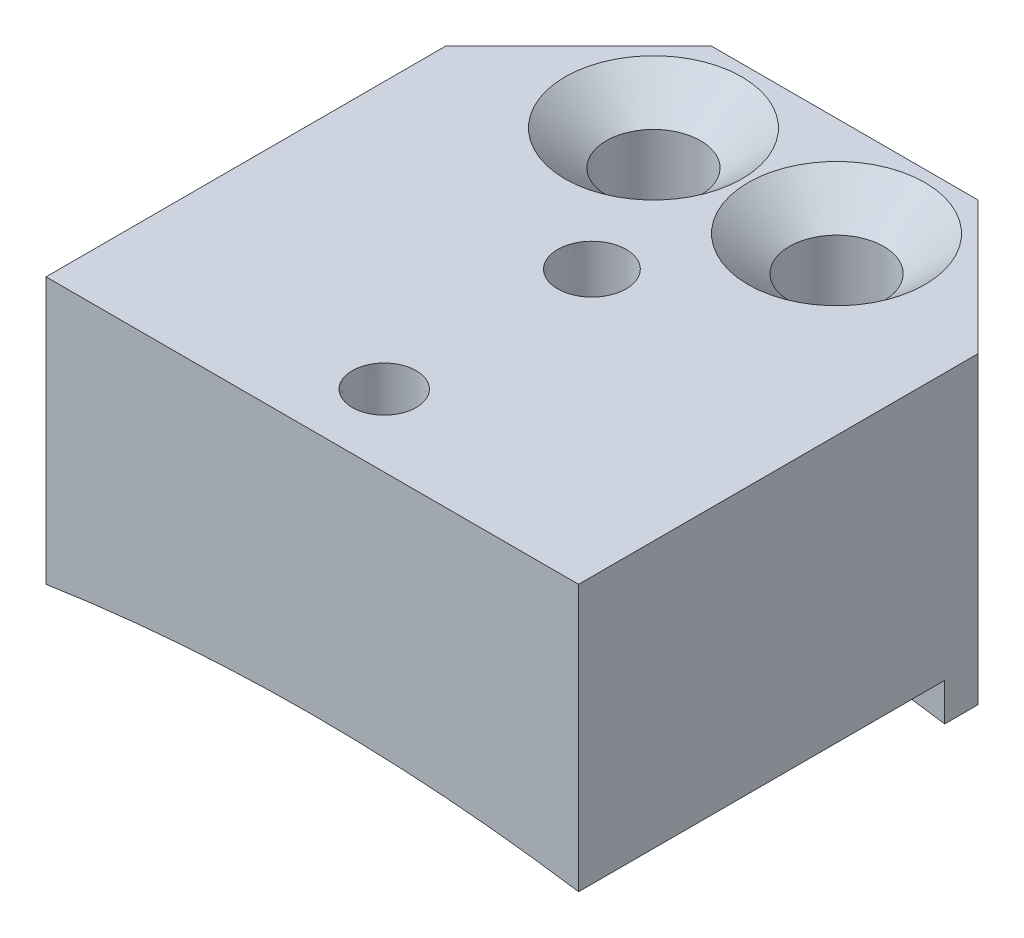
from build123d import *

# Parameters (mm, degrees)
BOSS_EXTRUDE1_DEPTH                               = 12.7
CUT_EXTRUDE1_DEPTH                                = 41.241448839
CUT_EXTRUDE1_DEPTH_BACK                           = 41.241448839
SKETCH2_R                                         = 83.82
BOSS_EXTRUDE2_DEPTH                               = 7.9375
CHAMFER1_SIZE                                     = 6.35
CSK_FOR_8_FLAT_HEAD_MACHINE_SCREW_100_D           = 4.4958
CSK_FOR_8_FLAT_HEAD_MACHINE_SCREW_100_CSINK_D     = 8.4328
CSK_FOR_8_FLAT_HEAD_MACHINE_SCREW_100_CSINK_ANGLE = 100
CUT_EXTRUDE2_DEPTH                                = 35.469591438


with BuildPart() as part:
    # Sketch1 → Boss-Extrude1 (new body)
    with BuildSketch(Plane(origin=(0, 0, 0), x_dir=(1, 0, 0), z_dir=(0, 1, 0))):
        Polygon((-28.511825699, 6.495271113), (-22.161825699, 12.845271113), (-9.461825699, 12.845271113), (-3.111825699, 6.495271113), (-3.111825699, -12.554728887), (-28.511825699, -12.554728887), align=None)
    extrude(amount=BOSS_EXTRUDE1_DEPTH)

    # Sketch2 → Cut-Extrude1 (cut, two sides: drawn at the far end of the back side and taken through both)
    with BuildSketch(Plane.XY.offset(12.554728887).offset(-CUT_EXTRUDE1_DEPTH_BACK)):
        with Locations((-15.811825699, -82.852292666)):
            Circle(SKETCH2_R)
    extrude(amount=CUT_EXTRUDE1_DEPTH + CUT_EXTRUDE1_DEPTH_BACK, mode=Mode.SUBTRACT)

    # Sketch5 → Boss-Extrude2 (add)
    with BuildSketch(Plane(origin=(0, 0, -12.845271113), x_dir=(-1, 0, 0), z_dir=(0, 0, -1))):
        with BuildLine():
            Line((3.111825699, 12.7), (3.111825699, 0))
            Line((3.111825699, 0), (3.111825699, -1.799225087))
            ThreePointArc((3.111825699, -1.799225087), (15.811825699, -0.810292666), (28.511825699, -1.799225087))
            Line((28.511825699, -1.799225087), (28.511825699, 0))
            Line((28.511825699, 0), (28.511825699, 12.7))
            Line((28.511825699, 12.7), (3.111825699, 12.7))
        make_face()
    extrude(amount=-BOSS_EXTRUDE2_DEPTH)

    # Chamfer1
    chamfer1_edges = [part.edges().sort_by_distance(p)[0] for p in [
        (-28.511825699, 5.450387457, -12.845271113),
        (-3.111825699, 5.450387457, -12.845271113),
    ]]
    chamfer(chamfer1_edges, length=CHAMFER1_SIZE)

    # CSK for #8 Flat Head Machine Screw (100)1 (through all)
    with Locations(Plane(origin=(0, 12.7, 0), x_dir=(1, 0, 0), z_dir=(0, 1, 0))):
        with Locations((-20.177450699, 8.082771113), (-11.446200699, 8.082771113)):
            CounterSinkHole(CSK_FOR_8_FLAT_HEAD_MACHINE_SCREW_100_D / 2, CSK_FOR_8_FLAT_HEAD_MACHINE_SCREW_100_CSINK_D / 2, counter_sink_angle=CSK_FOR_8_FLAT_HEAD_MACHINE_SCREW_100_CSINK_ANGLE)

    # Sketch6 → Cut-Extrude2 (cut, through all)
    with BuildSketch(Plane(origin=(0, 12.7, 0), x_dir=(1, 0, 0), z_dir=(0, 1, 0))):
        with BuildLine():
            add(Edge.make_bspline(
                [(-15.810187161, -10.649728887), (-15.608816069, -10.649728887), (-15.408777087, -10.609258042), (-15.042113414, -10.456913102), (-14.872283136, -10.343310195), (-14.661403237, -10.132093223), (-14.597095235, -10.053567675), (-14.486747252, -9.887951619), (-14.439987535, -9.800364966), (-14.325350321, -9.523041064), (-14.285983587, -9.325167956), (-14.286290626, -9.023681247), (-14.296234835, -8.924756645), (-14.335129975, -8.729941243), (-14.364583859, -8.633021866), (-14.441157352, -8.448760184), (-14.488024203, -8.361269055), (-14.59887818, -8.19554373), (-14.663276798, -8.117242645), (-14.874254427, -7.906673959), (-15.044430287, -7.793212195), (-15.411336895, -7.641510946), (-15.611812582, -7.601658558), (-15.910183793, -7.601764194), (-16.011184079, -7.611765087), (-16.206424053, -7.650777196), (-16.30141986, -7.679610607), (-16.578437934, -7.794438792), (-16.746192198, -7.906327472), (-16.959455446, -8.119808368), (-17.022421419, -8.196790525), (-17.132721662, -8.361961239), (-17.180436007, -8.451221081), (-17.256716781, -8.635734127), (-17.285478891, -8.730735016), (-17.324351045, -8.926195298), (-17.33424011, -9.027147637), (-17.3340816, -9.325321862), (-17.294056516, -9.525871287), (-17.142043719, -9.892631786), (-17.028500472, -10.062651874), (-16.817622682, -10.273567653), (-16.739189096, -10.337937728), (-16.573527751, -10.448531182), (-16.4859941, -10.495341779), (-16.301435, -10.571837459), (-16.204652049, -10.601138186), (-16.009875231, -10.63984903), (-15.910872707, -10.649728887), (-15.810187161, -10.649728887)],
                knots=[0, 0, 0, 0, 0.0625, 0.0625, 0.125, 0.125, 0.15625, 0.15625, 0.1875, 0.1875, 0.25, 0.25, 0.28125, 0.28125, 0.3125, 0.3125, 0.34375, 0.34375, 0.375, 0.375, 0.4375, 0.4375, 0.5, 0.5, 0.53125, 0.53125, 0.5625, 0.5625, 0.625, 0.625, 0.65625, 0.65625, 0.6875, 0.6875, 0.71875, 0.71875, 0.75, 0.75, 0.8125, 0.8125, 0.875, 0.875, 0.90625, 0.90625, 0.9375, 0.9375, 0.96875, 0.96875, 1, 1, 1, 1], degree=3))
        make_face()
        with BuildLine():
            add(Edge.make_bspline(
                [(-17.442014074, 0.780271113), (-17.442014074, 0.564636284), (-17.398676558, 0.350427917), (-17.235540464, -0.042207871), (-17.113890664, -0.224067842), (-16.887712317, -0.449885239), (-16.803624494, -0.518748425), (-16.626277278, -0.636912744), (-16.532486538, -0.686984635), (-16.235518686, -0.809742063), (-16.023629558, -0.851897237), (-15.700787746, -0.851568442), (-15.594856021, -0.840919858), (-15.386241213, -0.799269638), (-15.2824567, -0.767729417), (-15.085143228, -0.685731965), (-14.991454814, -0.635545363), (-14.813990575, -0.51683914), (-14.730143192, -0.447878932), (-14.50465928, -0.22195697), (-14.383160661, -0.039726886), (-14.220713993, 0.353169004), (-14.178038765, 0.567845014), (-14.178151883, 0.887350822), (-14.188861164, 0.995505271), (-14.230636596, 1.204574676), (-14.261512351, 1.30629934), (-14.343486893, 1.504059479), (-14.394580348, 1.59939761), (-14.512809992, 1.776109619), (-14.580489093, 1.858699522), (-14.732890677, 2.010945721), (-14.815325719, 2.078371766), (-14.992196017, 2.196484915), (-15.087778447, 2.247579015), (-15.285361108, 2.329262955), (-15.387091204, 2.360062361), (-15.596396557, 2.401687932), (-15.704499652, 2.412277461), (-16.023794479, 2.412107726), (-16.238549476, 2.369247574), (-16.631288933, 2.206467282), (-16.813352191, 2.084881425), (-17.03920796, 1.859066471), (-17.10813762, 1.77507717), (-17.226564819, 1.597681506), (-17.276691184, 1.503947566), (-17.358605332, 1.306315551), (-17.389981529, 1.202677168), (-17.431434394, 0.994103708), (-17.442014074, 0.888088528), (-17.442014074, 0.780271113)],
                knots=[0, 0, 0, 0, 0.0625, 0.0625, 0.125, 0.125, 0.15625, 0.15625, 0.1875, 0.1875, 0.25, 0.25, 0.28125, 0.28125, 0.3125, 0.3125, 0.34375, 0.34375, 0.375, 0.375, 0.4375, 0.4375, 0.5, 0.5, 0.53125, 0.53125, 0.5625, 0.5625, 0.59375, 0.59375, 0.625, 0.625, 0.65625, 0.65625, 0.6875, 0.6875, 0.71875, 0.71875, 0.75, 0.75, 0.8125, 0.8125, 0.875, 0.875, 0.90625, 0.90625, 0.9375, 0.9375, 0.96875, 0.96875, 1, 1, 1, 1], degree=3))
        make_face()
    extrude(amount=-CUT_EXTRUDE2_DEPTH, mode=Mode.SUBTRACT)


solid = part.part
